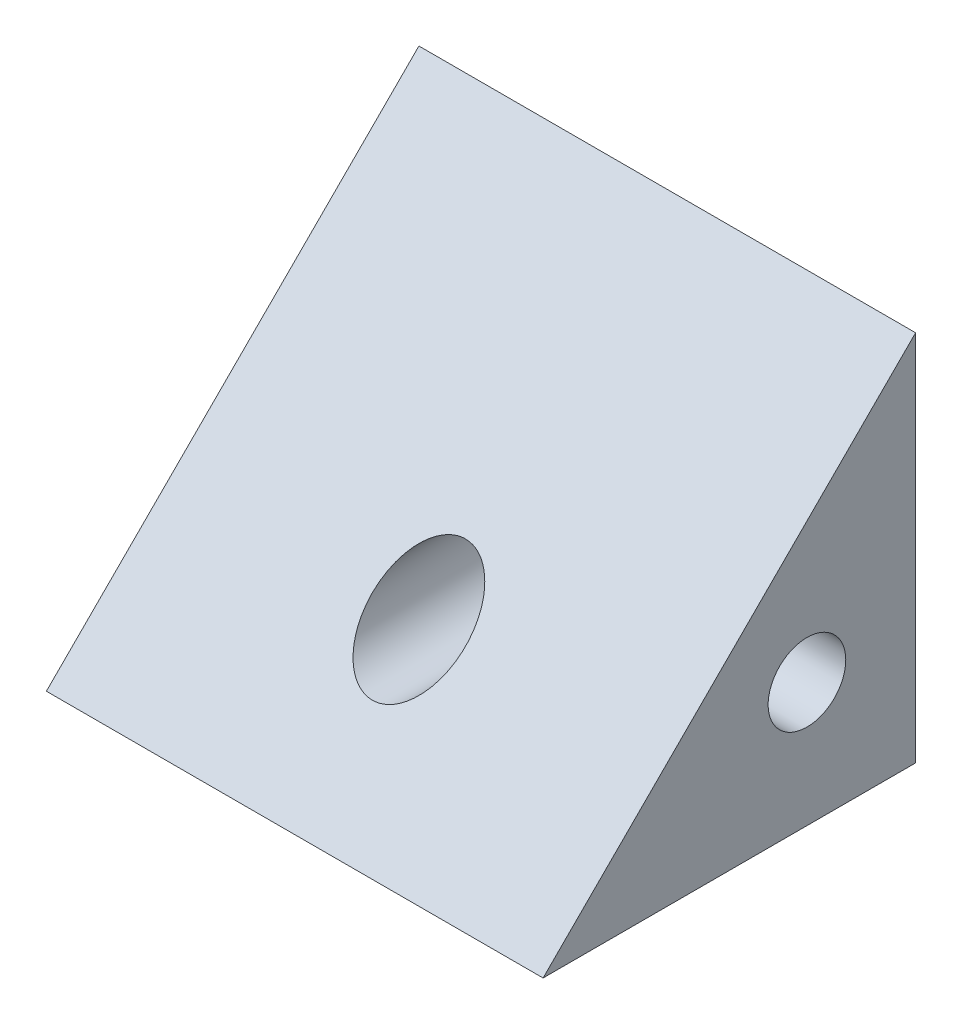
from build123d import *

# Parameters (mm, degrees)
ESQUISSE1_W             = 16
ESQUISSE1_H             = 12
EXTRUSION1_DEPTH        = 14
CHANFREIN1_SIZE         = 14
ESQUISSE3_R             = 1.5
ENL_V_MAT_EXTRU_2_DEPTH = 24.323807579
TROU_TARAUD_M3X0_51_D   = 2.5


with BuildPart() as part:
    # Esquisse1 → Extrusion1 (new body)
    with BuildSketch(Plane.XY):
        with Locations((8, 6)):
            Rectangle(ESQUISSE1_W, ESQUISSE1_H)
    extrude(amount=EXTRUSION1_DEPTH)

    # Chanfrein1
    # the kernel refuses this chamfer: 14 mm, written as the material it takes off along each edge
    with BuildSketch(Plane(origin=(52.003561832, 12, 14), x_dir=(0, 0.027495876610586365, -0.9996219169112968), z_dir=(-1, 0, 0))) as chanfrein1_piece_1:
        Polygon((CHANFREIN1_SIZE * 0.999621916911, CHANFREIN1_SIZE * 0.0274958766106), (-CHANFREIN1_SIZE * 0.0274958766106, CHANFREIN1_SIZE * 0.999621916911), (0, 0), align=None)
    extrude(amount=88.007123663, mode=Mode.SUBTRACT)

    # Esquisse3 → Enlèv. mat.-Extru.2 (cut, through all)
    with BuildSketch(Plane(origin=(0, 0, 0), x_dir=(-1, 0, 0), z_dir=(0, 0, -1))):
        with Locations((-8, 4)):
            Circle(ESQUISSE3_R)
    extrude(amount=-ENL_V_MAT_EXTRU_2_DEPTH, mode=Mode.SUBTRACT)

    # Trou taraudé M3x0.51 (through all)
    with Locations(Plane(origin=(16, 0, 0), x_dir=(0, 0, -1), z_dir=(1, 0, 0))):
        with Locations((-3.5, 4)):
            Hole(TROU_TARAUD_M3X0_51_D / 2)


solid = part.part
